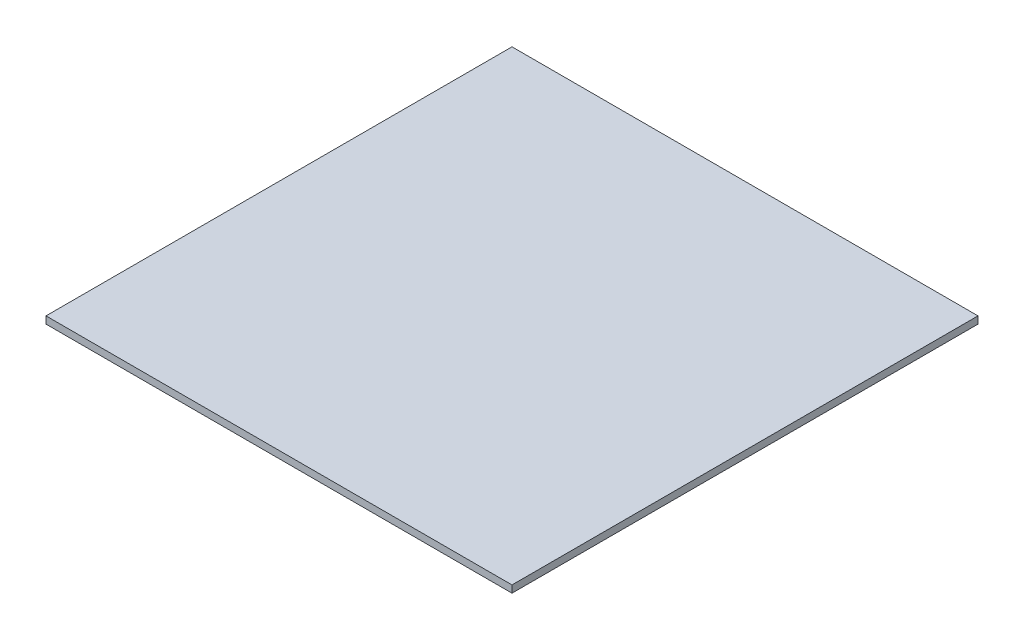
from build123d import *

# Parameters (mm, degrees)
SKETCH1_W           = 650
SKETCH1_H           = 650
BOSS_EXTRUDE1_DEPTH = 10


with BuildPart() as part:
    # Sketch1 → Boss-Extrude1 (new body)
    with BuildSketch(Plane(origin=(0, 0, 0), x_dir=(1, 0, 0), z_dir=(0, 1, 0))):
        Rectangle(SKETCH1_W, SKETCH1_H)
    extrude(amount=-BOSS_EXTRUDE1_DEPTH)


solid = part.part
